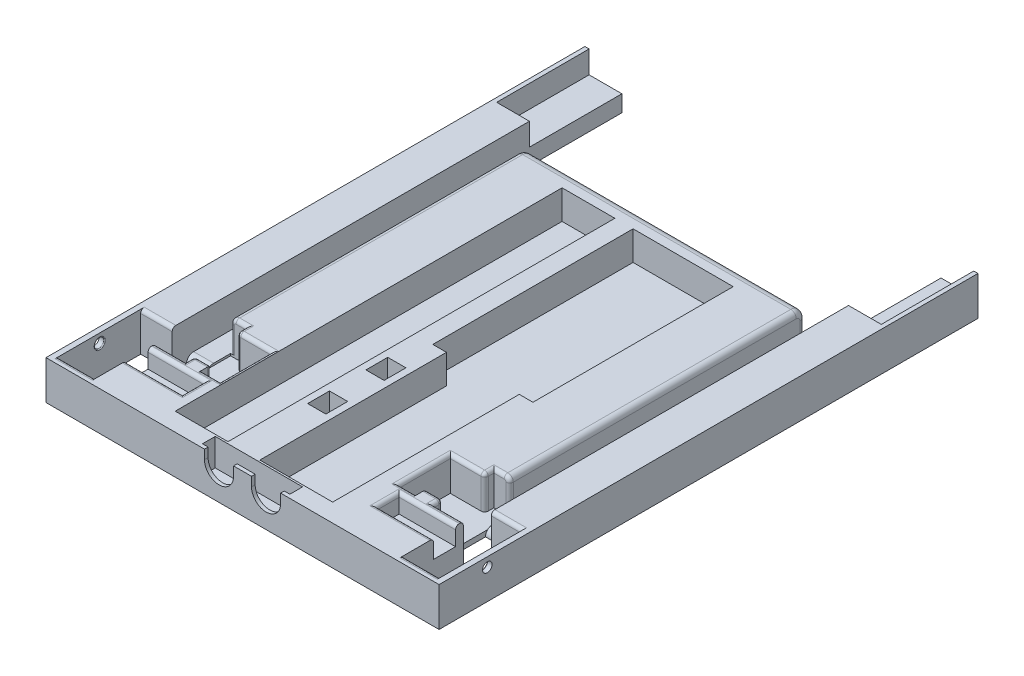
from build123d import *

# Parameters (mm, degrees)
BOSS_EXTRUDE1_DEPTH  = 21.38
FILLET9_R            = 5
CUT_EXTRUDE1_DEPTH   = 316.794722723
SKETCH2_4_W          = 31
SKETCH2_4_H          = 12.1
CUT_EXTRUDE2_DEPTH   = 10
CUT_EXTRUDE11_REACH  = 368.996
SKETCH8_R            = 2.625
FILLET8_R            = 0.5
FILLET2_R            = 2
SKETCH4_R            = 2.625
CUT_EXTRUDE4_DEPTH   = 6.12
SKETCH5_W            = 11
SKETCH5_H            = 175.72
SKETCH5_H_2          = 20
CUT_EXTRUDE5_DEPTH   = 17.38
CUT_EXTRUDE6_DEPTH   = 316.794722723
CUT_EXTRUDE7_DEPTH   = 18.52
SKETCH7_W            = 10
SKETCH7_H            = 5
CUT_EXTRUDE8_DEPTH   = 17.38
FILLET5_R            = 4
FILLET6_R            = 2
FILLET7_R            = 3
FILLET8_OF_MIRROR2_R = 0.5
FILLET2_OF_MIRROR2_R = 2
FILLET5_OF_MIRROR2_R = 4
FILLET6_OF_MIRROR2_R = 2
FILLET7_OF_MIRROR2_R = 3
SKETCH9_W            = 18
SKETCH9_H            = 50.8
CUT_EXTRUDE12_DEPTH  = 12.33
SKETCH10_W           = 29
SKETCH10_H           = 112.5
SKETCH10_H_2         = 50
SKETCH10_W_2         = 40
SKETCH10_H_3         = 102.5
SKETCH10_W_3         = 55
CUT_EXTRUDE13_DEPTH  = 16
SKETCH11_W           = 48
SKETCH11_H           = 7
CUT_EXTRUDE14_DEPTH  = 15
CUT_EXTRUDE15_DEPTH  = 2
SKETCH13_W           = 10
SKETCH13_H           = 12
CUT_EXTRUDE16_DEPTH  = 10


with BuildPart() as part:
    # Sketch1 → Boss-Extrude1 (new body)
    with BuildSketch(Plane(origin=(0, 0, 0), x_dir=(1, 0, 0), z_dir=(0, 1, 0))):
        Polygon((-87.63, 296), (-87.63, 232.5), (87.63, 232.5), (87.63, 296), (107.95, 296), (107.95, 0), (-107.95, 0), (-107.95, 296), align=None)
    extrude(amount=BOSS_EXTRUDE1_DEPTH)

    # Fillet9
    fillet9_edges = [part.edges().sort_by_distance(p)[0] for p in [
        (0, 21.38, -232.5),
    ]]
    fillet(fillet9_edges, radius=FILLET9_R)

    # Sketch2 → Cut-Extrude1 (cut, through all)
    with BuildSketch(Plane(origin=(0, 21.38, 0), x_dir=(1, 0, 0), z_dir=(0, 1, 0))):
        Polygon((-84.45, 20.45), (-84.45, 32.55), (-84.45, 49), (-104.95, 49), (-104.95, 29.25), (-104.95, 23.75), (-104.95, 4), (-84.45, 4), align=None)
    cut_extrude1 = extrude(amount=-CUT_EXTRUDE1_DEPTH, mode=Mode.SUBTRACT)

    # Sketch2<4> → Cut-Extrude2 (cut)
    with BuildSketch(Plane(origin=(0, 21.38, 0), x_dir=(1, 0, 0), z_dir=(0, 1, 0))):
        with Locations((-68.95, 26.5)):
            Rectangle(SKETCH2_4_W, SKETCH2_4_H)
    cut_extrude2 = extrude(amount=-CUT_EXTRUDE2_DEPTH, mode=Mode.SUBTRACT)

    # Sketch8 → Cut-Extrude11 (cut, up to next)
    with BuildSketch(Plane.ZY.offset(107.95), mode=Mode.PRIVATE) as cut_extrude11_sk1:
        with Locations((-26.5, 16.38)):
            Circle(SKETCH8_R)
    cut_extrude11_tool1 = extrude(cut_extrude11_sk1.sketch, amount=-CUT_EXTRUDE11_REACH, mode=Mode.PRIVATE) & part.part
    cut_extrude11 = cut_extrude11_tool1.solids().sort_by_distance((-107.95, 16.38, -26.5))[0]
    add(cut_extrude11, mode=Mode.SUBTRACT)

    # Fillet8
    fillet8_edges = [part.edges().sort_by_distance(p)[0] for p in [
        (-104.95, 16.38, -29.125),
    ]]
    fillet(fillet8_edges, radius=FILLET8_R)

    # Fillet2
    fillet2_edges = [part.edges().sort_by_distance(p)[0] for p in [
        (-94.7, 21.38, -49),
        (-94.7, 21.38, -4),
        (-53.45, 21.38, -26.5),
        (-68.95, 21.38, -32.55),
        (-68.95, 21.38, -20.45),
    ]]
    fillet(fillet2_edges, radius=FILLET2_R)

    # Sketch4 → Cut-Extrude4 (cut)
    with BuildSketch(Plane.XZ):
        with Locations(Location((0, -226.5, 0), (0, 0, 270))):
            Circle(SKETCH4_R)
    extrude(amount=-CUT_EXTRUDE4_DEPTH, mode=Mode.SUBTRACT)

    # Sketch5 → Cut-Extrude5 (cut)
    with BuildSketch(Plane(origin=(0, 21.38, 0), x_dir=(1, 0, 0), z_dir=(0, 1, 0))):
        with Locations((-82.13, 144.64)):
            Rectangle(SKETCH5_W, SKETCH5_H)
        with Locations((-82.13, 46.78)):
            Rectangle(SKETCH5_W, SKETCH5_H_2)
    cut_extrude5 = extrude(amount=-CUT_EXTRUDE5_DEPTH, mode=Mode.SUBTRACT)

    # Sketch5<3> → Cut-Extrude6 (cut, through all)
    with BuildSketch(Plane(origin=(0, 21.38, 0), x_dir=(1, 0, 0), z_dir=(0, 1, 0))):
        Polygon((-76.63, 56.78), (-87.63, 56.78), (-87.63, 51), (-87.63, 36.78), (-84.45, 36.78), (-76.63, 36.78), align=None)
    cut_extrude6 = extrude(amount=-CUT_EXTRUDE6_DEPTH, mode=Mode.SUBTRACT)

    # Sketch6 → Cut-Extrude7 (cut)
    with BuildSketch(Plane(origin=(0, 21.38, 0), x_dir=(1, 0, 0), z_dir=(0, 1, 0))):
        Polygon((-76.63, 36.78), (-67.99, 36.78), (-67.99, 41.88), (-49.13, 41.88), (-49.13, 64.98), (-67.99, 64.98), (-67.99, 70.08), (-76.63, 70.08), (-76.63, 64.98), align=None)
    cut_extrude7 = extrude(amount=-CUT_EXTRUDE7_DEPTH, mode=Mode.SUBTRACT)

    # Sketch7 → Cut-Extrude8 (cut)
    with BuildSketch(Plane(origin=(0, 21.38, 0), x_dir=(1, 0, 0), z_dir=(0, 1, 0))):
        with Locations((-54.13, 39.38)):
            Rectangle(SKETCH7_W, SKETCH7_H)
    cut_extrude8 = extrude(amount=-CUT_EXTRUDE8_DEPTH, mode=Mode.SUBTRACT)

    # Fillet5
    # the kernel refuses this fillet: 4 mm, written as the material it takes off along each edge
    with BuildSketch(Plane(origin=(-76.63, 4, -56.78), x_dir=(0, -1, 0), z_dir=(-1, 0, 0))) as fillet5_piece_1:
        with BuildLine():
            CenterArc((FILLET5_R, -FILLET5_R), FILLET5_R, 90, 90)
            Line((0, -FILLET5_R), (0, 0))
            Line((0, 0), (FILLET5_R, 0))
        make_face()
    extrude(amount=11, mode=Mode.SUBTRACT)

    # Fillet6
    fillet6_edges = [part.edges().sort_by_distance(p)[0] for p in [
        (-76.22, 21.38, -36.78),
        (-67.99, 21.38, -39.33),
        (-63.56, 21.38, -41.88),
        (-49.13, 21.38, -50.93),
        (-58.56, 21.38, -64.98),
        (-67.99, 21.38, -67.53),
        (-72.31, 21.38, -70.08),
        (-67.99, 12.12, -41.88),
        (-67.99, 12.12, -64.98),
        (-76.63, 12.69, -70.08),
        (-54.13, 21.38, -36.88),
        (-59.13, 12.69, -41.88),
    ]]
    fillet(fillet6_edges, radius=FILLET6_R)

    # Fillet7
    # the kernel refuses this fillet: 3 mm, written as the material it takes off along each edge
    with BuildSketch(Plane(origin=(-73.63, 18.38, -70.08), x_dir=(0, 1, 0), z_dir=(1, 0, 0))) as fillet7_piece_1:
        with BuildLine():
            CenterArc((1, -2), 2, 0, 90)
            Line((3, -2), (3, 0))
            Line((3, 0), (1, 0))
        make_face()
    revolve(axis=Axis((-73.63, 18.38, -70.08), (0, 0, 1)), revolution_arc=90, mode=Mode.SUBTRACT)
    with BuildSketch(Plane(origin=(-76.63, 16.38, -227.5), x_dir=(0, 0, -1), z_dir=(0, -1, 0))) as fillet7_piece_2:
        with BuildLine():
            CenterArc((5 - FILLET7_R, FILLET7_R), FILLET7_R, 270, 90)
            Line((5 - FILLET7_R, 0), (5, 0))
            Line((5, 0), (5, FILLET7_R))
        make_face()
    revolve(axis=Axis((-76.63, 16.38, -227.5), (1, 0, 0)), revolution_arc=90, mode=Mode.SUBTRACT)
    with BuildSketch(Plane(origin=(-76.63, 16.38, -232.5), x_dir=(1, 0, 0), z_dir=(0, -1, 0))) as fillet7_piece_3:
        with BuildLine():
            CenterArc((FILLET7_R, FILLET7_R), FILLET7_R, 180, 90)
            Line((0, FILLET7_R), (0, 0))
            Line((0, 0), (FILLET7_R, 0))
        make_face()
    extrude(amount=12.38, mode=Mode.SUBTRACT)
    with BuildSketch(Plane(origin=(-76.63, 21.38, -227.5), x_dir=(1, 0, 0), z_dir=(0, 0, 1))) as fillet7_piece_4:
        with BuildLine():
            CenterArc((FILLET7_R, -FILLET7_R), FILLET7_R, 90, 90)
            Line((0, -FILLET7_R), (0, 0))
            Line((0, 0), (FILLET7_R, 0))
        make_face()
    extrude(amount=157.42, mode=Mode.SUBTRACT)

    # Mirror2: Cut-Extrude1, Cut-Extrude2, Cut-Extrude11, Cut-Extrude5, Cut-Extrude6, Cut-Extrude7, Cut-Extrude8 across plane
    add(cut_extrude1.mirror(Plane(origin=(0, 0, 0), x_dir=(0, 0, 1), z_dir=(1, 0, 0))), mode=Mode.SUBTRACT)
    add(cut_extrude2.mirror(Plane(origin=(0, 0, 0), x_dir=(0, 0, 1), z_dir=(1, 0, 0))), mode=Mode.SUBTRACT)
    add(cut_extrude11.mirror(Plane(origin=(0, 0, 0), x_dir=(0, 0, 1), z_dir=(1, 0, 0))), mode=Mode.SUBTRACT)
    add(cut_extrude5.mirror(Plane(origin=(0, 0, 0), x_dir=(0, 0, 1), z_dir=(1, 0, 0))), mode=Mode.SUBTRACT)
    add(cut_extrude6.mirror(Plane(origin=(0, 0, 0), x_dir=(0, 0, 1), z_dir=(1, 0, 0))), mode=Mode.SUBTRACT)
    add(cut_extrude7.mirror(Plane(origin=(0, 0, 0), x_dir=(0, 0, 1), z_dir=(1, 0, 0))), mode=Mode.SUBTRACT)
    add(cut_extrude8.mirror(Plane(origin=(0, 0, 0), x_dir=(0, 0, 1), z_dir=(1, 0, 0))), mode=Mode.SUBTRACT)

    # Fillet8 of Mirror2
    fillet8_of_mirror2_edges = [part.edges().sort_by_distance(p)[0] for p in [
        (104.95, 16.38, -29.125),
    ]]
    fillet(fillet8_of_mirror2_edges, radius=FILLET8_OF_MIRROR2_R)

    # Fillet2 of Mirror2
    fillet2_of_mirror2_edges = [part.edges().sort_by_distance(p)[0] for p in [
        (94.7, 21.38, -49),
        (94.7, 21.38, -4),
        (53.45, 21.38, -26.5),
        (68.95, 21.38, -32.55),
        (68.95, 21.38, -20.45),
    ]]
    fillet(fillet2_of_mirror2_edges, radius=FILLET2_OF_MIRROR2_R)

    # Fillet5 of Mirror2
    # the kernel refuses this fillet: 4 mm, written as the material it takes off along each edge
    with BuildSketch(Plane(origin=(87.63, 4, -56.78), x_dir=(0, -1, 0), z_dir=(-1, 0, 0))) as fillet5_of_mirror2_piece_1:
        with BuildLine():
            CenterArc((FILLET5_OF_MIRROR2_R, -FILLET5_OF_MIRROR2_R), FILLET5_OF_MIRROR2_R, 90, 90)
            Line((0, -FILLET5_OF_MIRROR2_R), (0, 0))
            Line((0, 0), (FILLET5_OF_MIRROR2_R, 0))
        make_face()
    extrude(amount=11, mode=Mode.SUBTRACT)

    # Fillet6 of Mirror2
    fillet6_of_mirror2_edges = [part.edges().sort_by_distance(p)[0] for p in [
        (76.22, 21.38, -36.78),
        (67.99, 21.38, -39.33),
        (63.56, 21.38, -41.88),
        (49.13, 21.38, -50.93),
        (58.56, 21.38, -64.98),
        (67.99, 21.38, -67.53),
        (72.31, 21.38, -70.08),
        (67.99, 12.12, -41.88),
        (67.99, 12.12, -64.98),
        (76.63, 12.69, -70.08),
        (54.13, 21.38, -36.88),
        (59.13, 12.69, -41.88),
    ]]
    fillet(fillet6_of_mirror2_edges, radius=FILLET6_OF_MIRROR2_R)

    # Fillet7 of Mirror2
    # the kernel refuses this fillet: 3 mm, written as the material it takes off along each edge
    with BuildSketch(Plane(origin=(73.63, 18.38, -70.08), x_dir=(1, 0, 0), z_dir=(0, -1, 0))) as fillet7_of_mirror2_piece_1:
        with BuildLine():
            CenterArc((1, -2), 2, 0, 90)
            Line((3, -2), (3, 0))
            Line((3, 0), (1, 0))
        make_face()
    revolve(axis=Axis((73.63, 18.38, -70.08), (0, 0, 1)), revolution_arc=90, mode=Mode.SUBTRACT)
    with BuildSketch(Plane(origin=(76.63, 16.38, -227.5), x_dir=(0, 0, -1), z_dir=(0, -1, 0))) as fillet7_of_mirror2_piece_2:
        with BuildLine():
            CenterArc((5 - FILLET7_OF_MIRROR2_R, -FILLET7_OF_MIRROR2_R), FILLET7_OF_MIRROR2_R, 0, 90)
            Line((5, -FILLET7_OF_MIRROR2_R), (5, 0))
            Line((5, 0), (5 - FILLET7_OF_MIRROR2_R, 0))
        make_face()
    revolve(axis=Axis((76.63, 16.38, -227.5), (1, 0, 0)), revolution_arc=90, mode=Mode.SUBTRACT)
    with BuildSketch(Plane(origin=(76.63, 16.38, -232.5), x_dir=(0, 0, 1), z_dir=(0, -1, 0))) as fillet7_of_mirror2_piece_3:
        with BuildLine():
            CenterArc((FILLET7_OF_MIRROR2_R, FILLET7_OF_MIRROR2_R), FILLET7_OF_MIRROR2_R, 180, 90)
            Line((0, FILLET7_OF_MIRROR2_R), (0, 0))
            Line((0, 0), (FILLET7_OF_MIRROR2_R, 0))
        make_face()
    extrude(amount=12.38, mode=Mode.SUBTRACT)
    with BuildSketch(Plane(origin=(76.63, 21.38, -70.08), x_dir=(0, -1, 0), z_dir=(0, 0, -1))) as fillet7_of_mirror2_piece_4:
        with BuildLine():
            CenterArc((FILLET7_OF_MIRROR2_R, FILLET7_OF_MIRROR2_R), FILLET7_OF_MIRROR2_R, 180, 90)
            Line((0, FILLET7_OF_MIRROR2_R), (0, 0))
            Line((0, 0), (FILLET7_OF_MIRROR2_R, 0))
        make_face()
    extrude(amount=157.42, mode=Mode.SUBTRACT)

    # Sketch9 → Cut-Extrude12 (cut)
    with BuildSketch(Plane(origin=(0, 21.38, 0), x_dir=(1, 0, 0), z_dir=(0, 1, 0))):
        with Locations((-96.63, 270.6)):
            Rectangle(SKETCH9_W, SKETCH9_H)
        with Locations((96.63, 270.6)):
            Rectangle(SKETCH9_W, SKETCH9_H)
    extrude(amount=-CUT_EXTRUDE12_DEPTH, mode=Mode.SUBTRACT)

    # Sketch10 → Cut-Extrude13 (cut)
    with BuildSketch(Plane(origin=(0, 21.38, 0), x_dir=(1, 0, 0), z_dir=(0, 1, 0))):
        with Locations((-32.5, 66.25)):
            Rectangle(SKETCH10_W, SKETCH10_H)
        with Locations((-32.5, 147.5)):
            Rectangle(SKETCH10_W, SKETCH10_H_2)
        with Locations((19.5, 61.25)):
            Rectangle(SKETCH10_W_2, SKETCH10_H_3)
        Polygon((47, 172.5), (-8, 172.5), (-8, 112.5), (-0.5, 112.5), (39.5, 112.5), (47, 112.5), align=None)
        with Locations((-32.5, 197.5)):
            Rectangle(SKETCH10_W, SKETCH10_H_2)
        with Locations((19.5, 197.5)):
            Rectangle(SKETCH10_W_3, SKETCH10_H_2)
    extrude(amount=-CUT_EXTRUDE13_DEPTH, mode=Mode.SUBTRACT)

    # Sketch11 → Cut-Extrude14 (cut)
    with BuildSketch(Plane(origin=(0, 21.38, 0), x_dir=(1, 0, 0), z_dir=(0, 1, 0))):
        with Locations((0, 5.5)):
            Rectangle(SKETCH11_W, SKETCH11_H)
    extrude(amount=-CUT_EXTRUDE14_DEPTH, mode=Mode.SUBTRACT)

    # Sketch12 → Cut-Extrude15 (cut)
    with BuildSketch(Plane.XY):
        with BuildLine():
            Line((-20.925, 21.38), (-20.925, 16.38))
            ThreePointArc((-20.925, 16.38), (-12.925, 8.38), (-4.925, 16.38))
            Line((-4.925, 16.38), (-4.925, 21.38))
            Line((-4.925, 21.38), (-20.925, 21.38))
        make_face()
        with BuildLine():
            Line((20.925, 21.38), (4.925, 21.38))
            Line((4.925, 21.38), (4.925, 16.38))
            ThreePointArc((4.925, 16.38), (12.925, 8.38), (20.925, 16.38))
            Line((20.925, 16.38), (20.925, 21.38))
        make_face()
    extrude(amount=-CUT_EXTRUDE15_DEPTH, mode=Mode.SUBTRACT)

    # Sketch13 → Cut-Extrude16 (cut)
    with BuildSketch(Plane(origin=(0, 21.38, 0), x_dir=(1, 0, 0), z_dir=(0, 1, 0))):
        with Locations((-9.25, 88)):
            Rectangle(SKETCH13_W, SKETCH13_H)
        with Locations((-9.25, 56)):
            Rectangle(SKETCH13_W, SKETCH13_H)
    extrude(amount=-CUT_EXTRUDE16_DEPTH, mode=Mode.SUBTRACT)


solid = part.part
